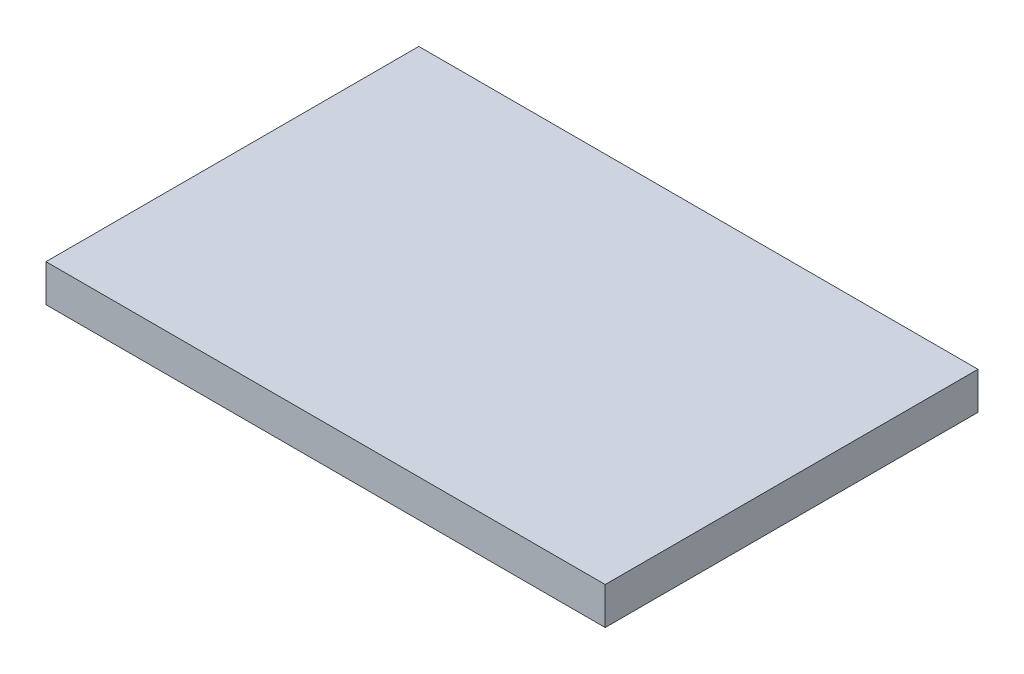
from build123d import *

# Parameters (mm, degrees)
SKETCH1_W           = 75
SKETCH1_H           = 50
BOSS_EXTRUDE1_DEPTH = 5


with BuildPart() as part:
    # Sketch1 → Boss-Extrude1 (new body)
    with BuildSketch(Plane(origin=(0, 0, 0), x_dir=(1, 0, 0), z_dir=(0, 1, 0))):
        with Locations((37.5, 0)):
            Rectangle(SKETCH1_W, SKETCH1_H)
    extrude(amount=BOSS_EXTRUDE1_DEPTH)


solid = part.part
